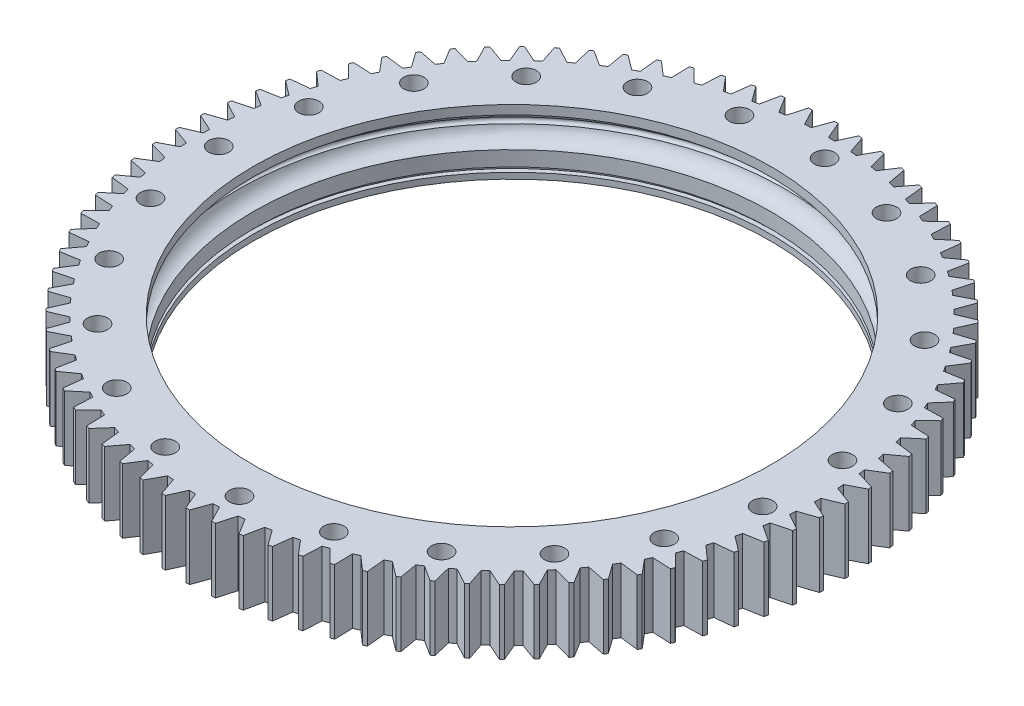
from build123d import *

# Parameters (mm, degrees)
ESQUISSE4_R                  = 6.75
ENL_V_MAT_EXTRU_2_DEPTH      = 313.893664046
R_P_TITION_CIRCULAIRE1_COUNT = 23
ENL_V_MAT_EXTRU_3_DEPTH      = 313.893664046
R_P_TITION_CIRCULAIRE2_COUNT = 84


with BuildPart() as part:
    # Esquisse1 → Révolution1 (revolve)
    with BuildSketch(Plane.XY):
        with BuildLine():
            Line((-219.15, 36), (-219.15, -7))
            Line((-219.15, -7), (-172, -7))
            Line((-172, -7), (-172, -3))
            Line((-172, -3), (-175, -3))
            Line((-175, -3), (-175, 0))
            Line((-175, 0), (-172, 0))
            Line((-172, 0), (-172, 10))
            ThreePointArc((-172, 10), (-178.333651811, 12.261469472), (-181.802631579, 18.023029052))
            ThreePointArc((-181.802631579, 18.023029052), (-183.5, 20), (-181.802631579, 21.976970948))
            ThreePointArc((-181.802631579, 21.976970948), (-178.333651811, 27.738530528), (-172, 30))
            Line((-172, 30), (-172, 36))
            Line((-172, 36), (-219.15, 36))
        make_face()
    revolve(axis=Axis((0, 43, 0), (0, -1, 0)))

    # Esquisse4 → Enlèv. mat.-Extru.2 (cut, through all)
    with BuildSketch(Plane(origin=(0, 36, 0), x_dir=(1, 0, 0), z_dir=(0, 1, 0))):
        with Locations((-195, 0)):
            Circle(ESQUISSE4_R)
    enl_v_mat_extru_2 = extrude(amount=-ENL_V_MAT_EXTRU_2_DEPTH, mode=Mode.SUBTRACT)

    # Répétition circulaire1: Enlèv. mat.-Extru.2 ×23 about axis
    r_p_tition_circulaire1_axis = Axis((0, 45.15, 0), (0, -1, 0))
    for i in range(1, R_P_TITION_CIRCULAIRE1_COUNT):
        add(enl_v_mat_extru_2.rotate(r_p_tition_circulaire1_axis, i * 360 / R_P_TITION_CIRCULAIRE1_COUNT), mode=Mode.SUBTRACT)

    # Esquisse5 → Enlèv. mat.-Extru.3 (cut, through all)
    with BuildSketch(Plane(origin=(0, 36, 0), x_dir=(1, 0, 0), z_dir=(0, 1, 0))):
        with BuildLine():
            ThreePointArc((-219.100562415, -4.654680386), (-219.137640255, -2.327471459), (-219.15, 0))
            Line((-219.15, 0), (-230.59542416, 0))
            Line((-230.59542416, 0), (-230.59542416, -19.639867766))
            Line((-230.59542416, -19.639867766), (-218.359444657, -18.597726447))
            Line((-218.359444657, -18.597726447), (-207.494803107, -12.973691982))
            ThreePointArc((-207.494803107, -12.973691982), (-207.61432949, -10.894961691), (-207.713031203, -8.815138585))
            Line((-207.713031203, -8.815138585), (-219.100562415, -4.654680386))
        make_face()
    enl_v_mat_extru_3 = extrude(amount=-ENL_V_MAT_EXTRU_3_DEPTH, mode=Mode.SUBTRACT)

    # Répétition circulaire2: Enlèv. mat.-Extru.3 ×84 about axis
    r_p_tition_circulaire2_axis = Axis((0, 45.15, 0), (0, -1, 0))
    for i in range(1, R_P_TITION_CIRCULAIRE2_COUNT):
        add(enl_v_mat_extru_3.rotate(r_p_tition_circulaire2_axis, i * 360 / R_P_TITION_CIRCULAIRE2_COUNT), mode=Mode.SUBTRACT)


solid = part.part
